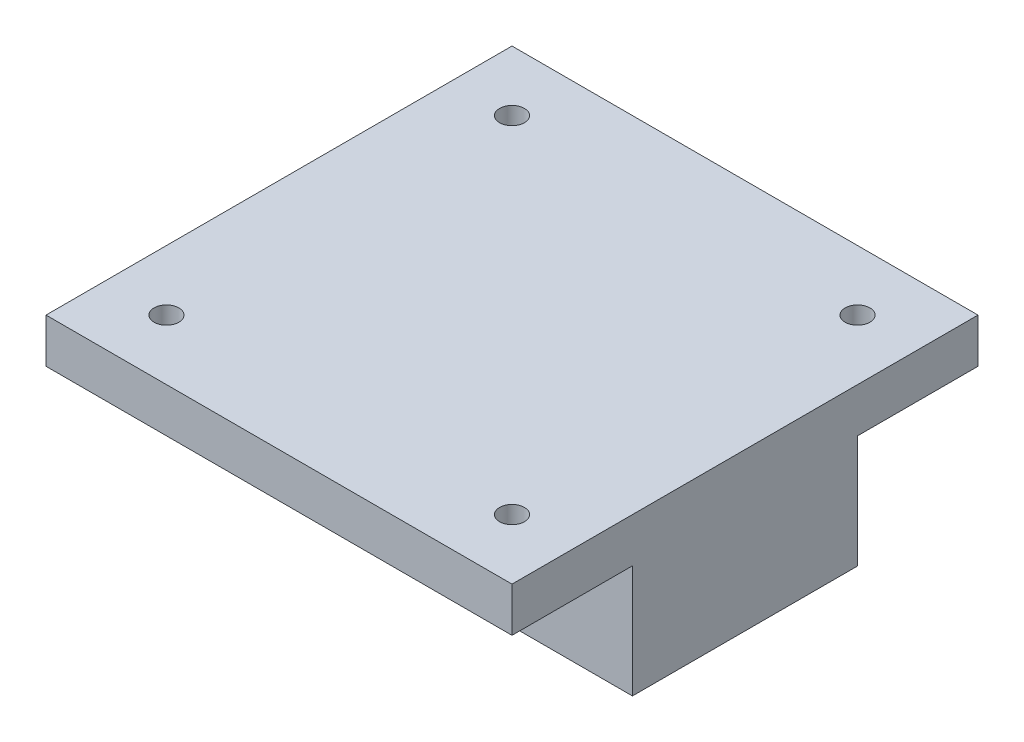
from build123d import *

# Parameters (mm, degrees)
SKETCH1_W           = 105
SKETCH1_H           = 105
SKETCH1_R           = 2.8
BOSS_EXTRUDE1_DEPTH = 10
SKETCH1_3_W         = 105
SKETCH1_3_H         = 50.725
BOSS_EXTRUDE2_DEPTH = 25.4


with BuildPart() as part:
    # Sketch1 → Boss-Extrude1 (new body)
    with BuildSketch(Plane(origin=(0, 0, 0), x_dir=(1, 0, 0), z_dir=(0, 1, 0))):
        Rectangle(SKETCH1_W, SKETCH1_H)
        with Locations((38.93125, 38.93125)):
            Circle(SKETCH1_R, mode=Mode.SUBTRACT)
        with Locations((-38.93125, 38.93125)):
            Circle(SKETCH1_R, mode=Mode.SUBTRACT)
        with Locations((38.93125, -38.93125)):
            Circle(SKETCH1_R, mode=Mode.SUBTRACT)
        with Locations((-38.93125, -38.93125)):
            Circle(SKETCH1_R, mode=Mode.SUBTRACT)
    extrude(amount=BOSS_EXTRUDE1_DEPTH)

    # Sketch1<3> → Boss-Extrude2 (add)
    with BuildSketch(Plane(origin=(0, 0, 0), x_dir=(1, 0, 0), z_dir=(0, 1, 0))):
        Rectangle(SKETCH1_3_W, SKETCH1_3_H)
    extrude(amount=-BOSS_EXTRUDE2_DEPTH)


solid = part.part
